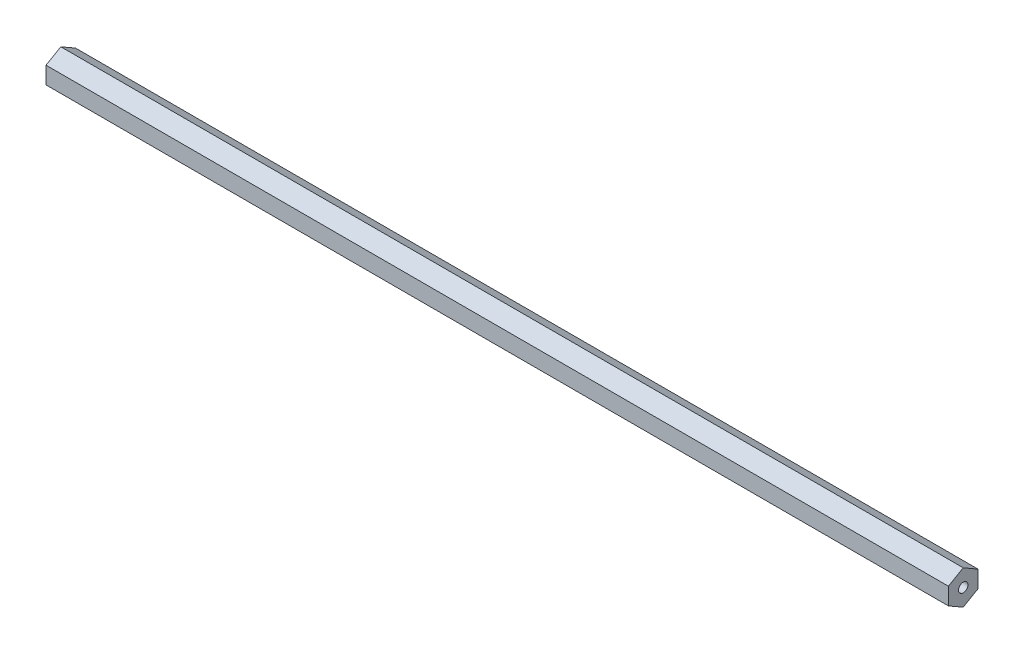
from build123d import *

# Parameters (mm, degrees)
BOSS_EXTRUDE1_DEPTH                  = 193.64325
F_10_32_TAPPED_HOLE1_D               = 4.0386
F_10_32_TAPPED_HOLE1_DEPTH           = 12.02944
F_10_32_TAPPED_HOLE1_TIP             = 1.213317848
F_10_32_TAPPED_HOLE1_ON_FACE_2_D     = 4.0386
F_10_32_TAPPED_HOLE1_ON_FACE_2_DEPTH = 12.02944
F_10_32_TAPPED_HOLE1_ON_FACE_2_TIP   = 1.213317848


with BuildPart() as part:
    # Sketch1 → Boss-Extrude1 (new, symmetric)
    with BuildSketch(Plane(origin=(0, 0, 0), x_dir=(0, 0, -1), z_dir=(1, 0, 0))):
        Polygon((0, 7.332348419), (-6.35, 3.666174209), (-6.35, -3.666174209), (0, -7.332348419), (6.35, -3.666174209), (6.35, 3.666174209), align=None)
    extrude(amount=BOSS_EXTRUDE1_DEPTH, both=True)

    # #10-32 Tapped Hole1
    with Locations(Plane(origin=(193.64325, 0, 0), x_dir=(0, 0, 1), z_dir=(1, 0, 0))):
        with Locations((0, 0)):
            Hole(F_10_32_TAPPED_HOLE1_D / 2, depth=F_10_32_TAPPED_HOLE1_DEPTH)
            with Locations((0, 0, -(F_10_32_TAPPED_HOLE1_DEPTH + F_10_32_TAPPED_HOLE1_TIP / 2))):  # 118° drill point
                Cone(0, F_10_32_TAPPED_HOLE1_D / 2, F_10_32_TAPPED_HOLE1_TIP, mode=Mode.SUBTRACT)

    # #10-32 Tapped Hole1 on face 2
    with Locations(Plane(origin=(-193.64325, 0, 0), x_dir=(0, 0, -1), z_dir=(-1, 0, 0))):
        with Locations((0, 0)):
            Hole(F_10_32_TAPPED_HOLE1_ON_FACE_2_D / 2, depth=F_10_32_TAPPED_HOLE1_ON_FACE_2_DEPTH)
            with Locations((0, 0, -(F_10_32_TAPPED_HOLE1_ON_FACE_2_DEPTH + F_10_32_TAPPED_HOLE1_ON_FACE_2_TIP / 2))):  # 118° drill point
                Cone(0, F_10_32_TAPPED_HOLE1_ON_FACE_2_D / 2, F_10_32_TAPPED_HOLE1_ON_FACE_2_TIP, mode=Mode.SUBTRACT)


solid = part.part
